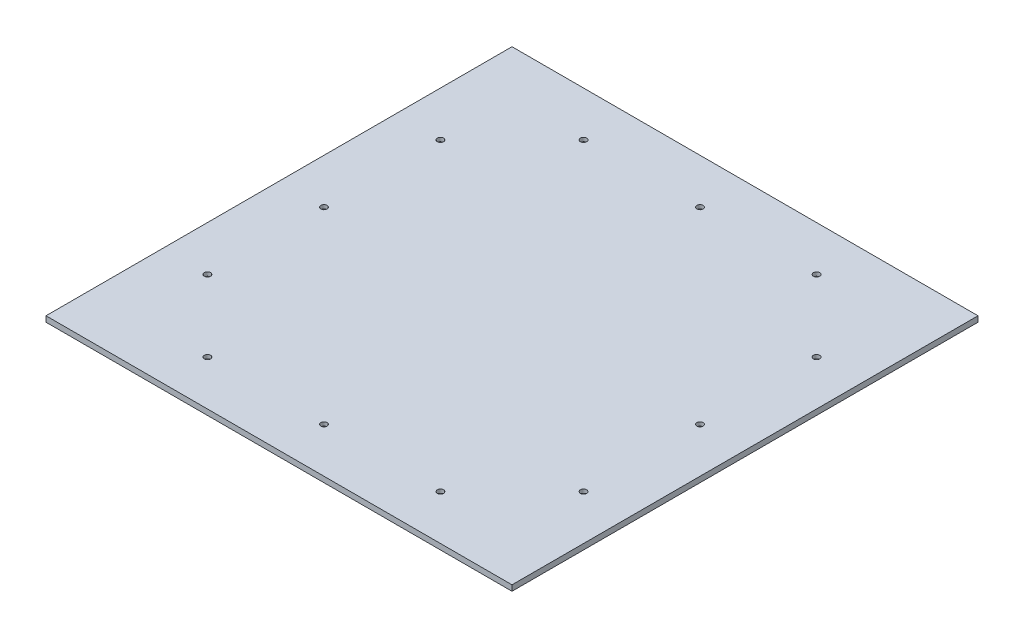
from build123d import *

# Parameters (mm, degrees)
SQUARE_W                                          = 131.642358
SQUARE_H                                          = 131.642358
EXTRUDE1_DEPTH                                    = 1.5875
CSK_FOR_0_FLAT_HEAD_MACHINE_SCREW_100_D           = 1.778
CSK_FOR_0_FLAT_HEAD_MACHINE_SCREW_100_CSINK_D     = 3.0226
CSK_FOR_0_FLAT_HEAD_MACHINE_SCREW_100_CSINK_ANGLE = 100
CIRPATTERN1_COUNT                                 = 4


with BuildPart() as part:
    # square → Extrude1 (new body)
    with BuildSketch(Plane(origin=(0, -75.346179, 0), x_dir=(1, 0, 0), z_dir=(0, 1, 0))):
        Rectangle(SQUARE_W, SQUARE_H)
    extrude(amount=-EXTRUDE1_DEPTH)

    # CSK for #0 Flat Head Machine Screw (100)1 (through all)
    with Locations(Plane(origin=(32.9105895, -76.933679, -53.121179), x_dir=(0, 0, -1), z_dir=(0, -1, 0))):
        with Locations((0, 0), (0, -32.9105895), (0, -65.821179)):
            csk_for_0_flat_head_machine_screw_100 = CounterSinkHole(CSK_FOR_0_FLAT_HEAD_MACHINE_SCREW_100_D / 2, CSK_FOR_0_FLAT_HEAD_MACHINE_SCREW_100_CSINK_D / 2, counter_sink_angle=CSK_FOR_0_FLAT_HEAD_MACHINE_SCREW_100_CSINK_ANGLE)

    # CirPattern1: CSK for #0 Flat Head Machine Screw (100)1 ×4 about axis
    cirpattern1_axis = Axis((0, -94.293127087, 0), (0, 1, 0))
    for i in range(1, CIRPATTERN1_COUNT):
        add(csk_for_0_flat_head_machine_screw_100.rotate(cirpattern1_axis, i * 360 / CIRPATTERN1_COUNT), mode=Mode.SUBTRACT)


solid = part.part
